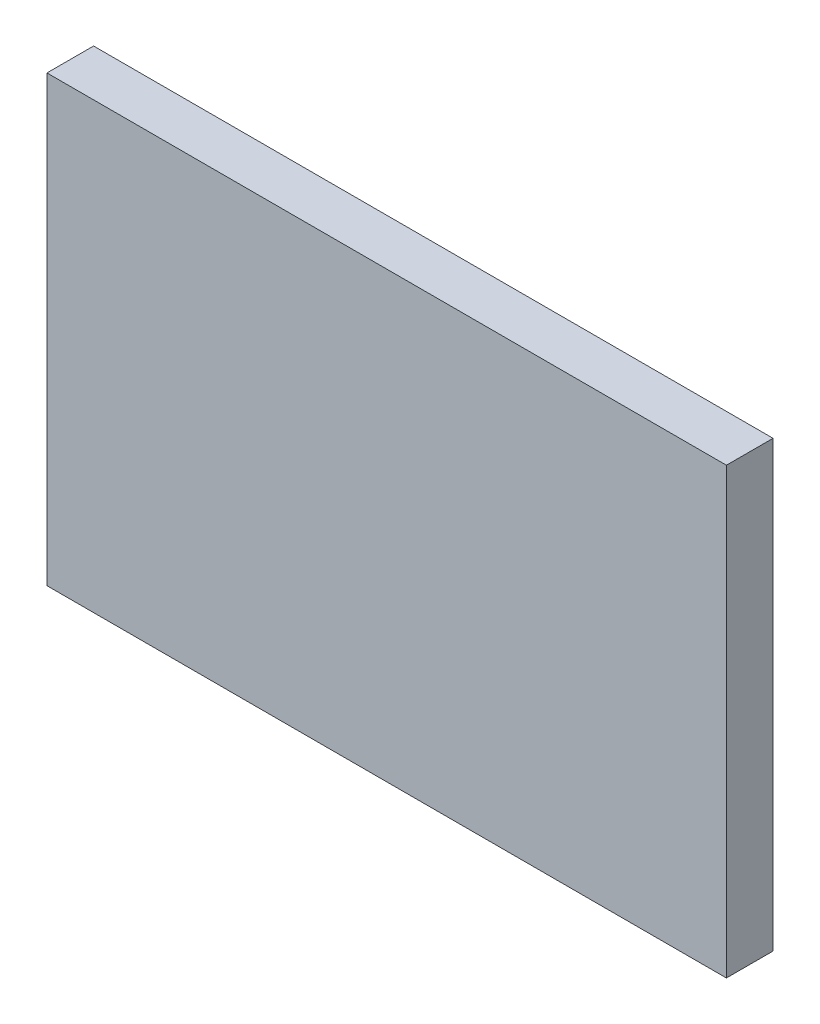
from build123d import *

# Parameters (mm, degrees)
SKETCH1_W           = 77.724
SKETCH1_H           = 50.8
BOSS_EXTRUDE1_DEPTH = 5.334


with BuildPart() as part:
    # Sketch1 → Boss-Extrude1 (new body)
    with BuildSketch(Plane.XY):
        Rectangle(SKETCH1_W, SKETCH1_H)
    extrude(amount=BOSS_EXTRUDE1_DEPTH)


solid = part.part
